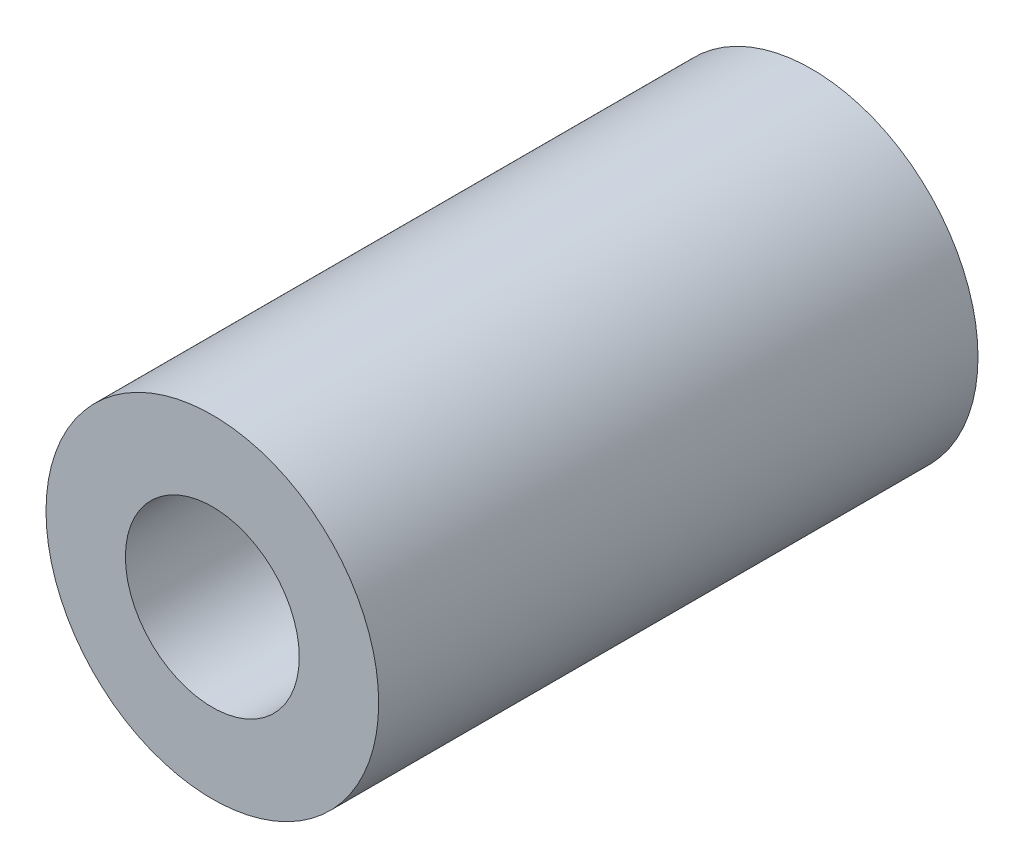
from build123d import *

# Parameters (mm, degrees)
SKETCH1_R           = 4.7625
SKETCH1_R_2         = 2.4892
BOSS_EXTRUDE1_DEPTH = 8.58012


with BuildPart() as part:
    # Sketch1 → Boss-Extrude1 (new, symmetric)
    with BuildSketch(Plane.XY):
        Circle(SKETCH1_R)
        Circle(SKETCH1_R_2, mode=Mode.SUBTRACT)
    extrude(amount=BOSS_EXTRUDE1_DEPTH, both=True)


solid = part.part
